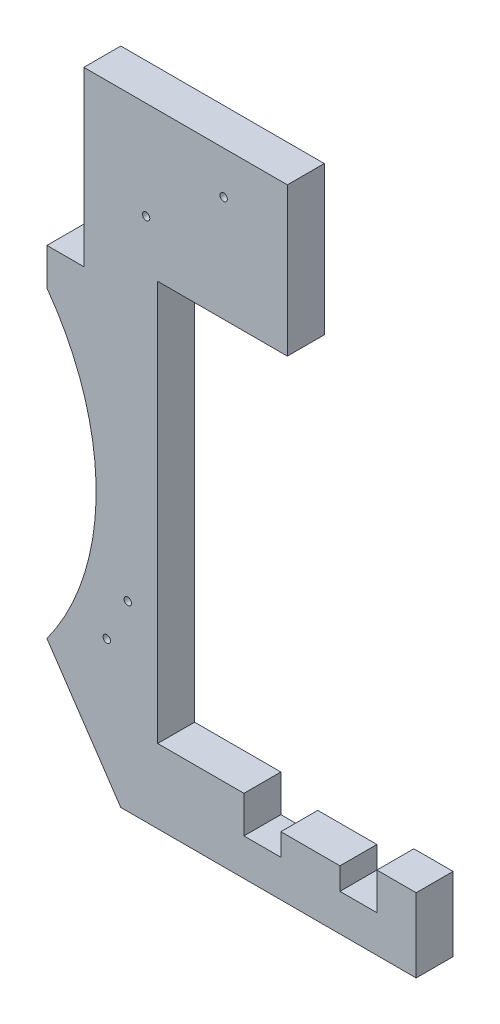
from build123d import *

# Parameters (mm, degrees)
BOSS_EXTRU_1_DEPTH      = 5
ESQUISSE3_R             = 0.5
ENL_V_MAT_EXTRU_1_DEPTH = 5


with BuildPart() as part:
    # Esquisse1 → Boss.-Extru.1 (new body)
    with BuildSketch(Plane.XY):
        with BuildLine():
            Line((50, 0), (50, 10))
            Line((50, 10), (15, 10))
            Line((15, 10), (15, 64.203101523))
            Line((15, 64.203101523), (32.561057994, 64.203101523))
            Line((32.561057994, 64.203101523), (32.561057994, 84.294650344))
            Line((32.561057994, 84.294650344), (5, 84.294650344))
            Line((5, 84.294650344), (5, 60.912399745))
            Line((5, 60.912399745), (0, 60.912399745))
            Line((0, 60.912399745), (0, 55.912399745))
            ThreePointArc((0, 55.912399745), (6.66837561, 35.361996844), (0, 14.811593943))
            Line((0, 14.811593943), (10, 0))
            Line((10, 0), (50, 0))
        make_face()
    extrude(amount=BOSS_EXTRU_1_DEPTH)

    # Esquisse3 → Enlèv. mat.-Extru.1 (cut)
    with BuildSketch(Plane(origin=(0, 0, 0), x_dir=(-1, 0, 0), z_dir=(0, 0, -1))):
        with Locations((-8.102621288, 18.817482708)):
            Circle(ESQUISSE3_R)
        with Locations((-10.949471373, 24.660893064)):
            Circle(ESQUISSE3_R)
        with Locations((-23.930149713, 78.544650344)):
            Circle(ESQUISSE3_R)
        with Locations((-13.430149713, 71.044650344)):
            Circle(ESQUISSE3_R)
        Polygon((-39.680149713, 8), (-31.680149713, 8), (-31.680149713, 5), (-26.680149713, 5), (-26.680149713, 10), (-44.680149713, 10), (-44.680149713, 5), (-39.680149713, 5), align=None)
    extrude(amount=-ENL_V_MAT_EXTRU_1_DEPTH, mode=Mode.SUBTRACT)


solid = part.part
